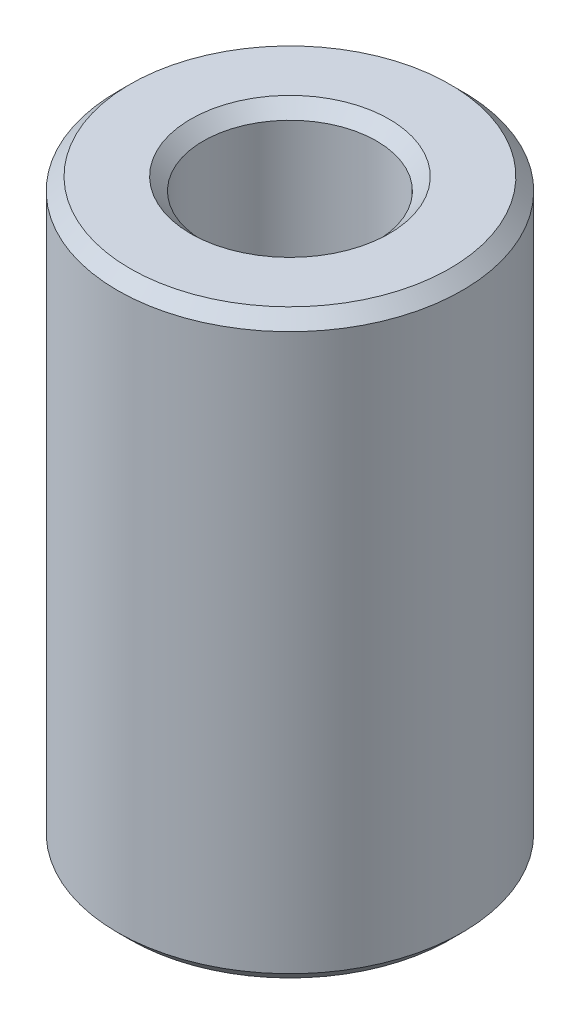
from build123d import *

# Parameters (mm, degrees)
SKETCH1_R           = 37.5
BOSS_EXTRUDE1_DEPTH = 126.442121758
SKETCH2_R           = 18.846422453
CUT_EXTRUDE1_DEPTH  = 138.1134937
CHAMFER1_SIZE       = 2.744604932


with BuildPart() as part:
    # Sketch1 → Boss-Extrude1 (new body)
    with BuildSketch(Plane(origin=(0, 0, 0), x_dir=(1, 0, 0), z_dir=(0, 1, 0))):
        Circle(SKETCH1_R)
    extrude(amount=BOSS_EXTRUDE1_DEPTH)

    # Sketch2 → Cut-Extrude1 (cut, through all)
    with BuildSketch(Plane(origin=(0, 0, 0), x_dir=(1, 0, 0), z_dir=(0, 1, 0))):
        Circle(SKETCH2_R)
    extrude(amount=CUT_EXTRUDE1_DEPTH, mode=Mode.SUBTRACT)

    # Chamfer1
    chamfer1_edges = [part.edges().sort_by_distance(p)[0] for p in [
        (-18.846422453, 126.442121758, 0),
        (-18.846422453, 0, 0),
        (-37.5, 0, 0),
        (-37.5, 126.442121758, 0),
    ]]
    chamfer(chamfer1_edges, length=CHAMFER1_SIZE)


solid = part.part
